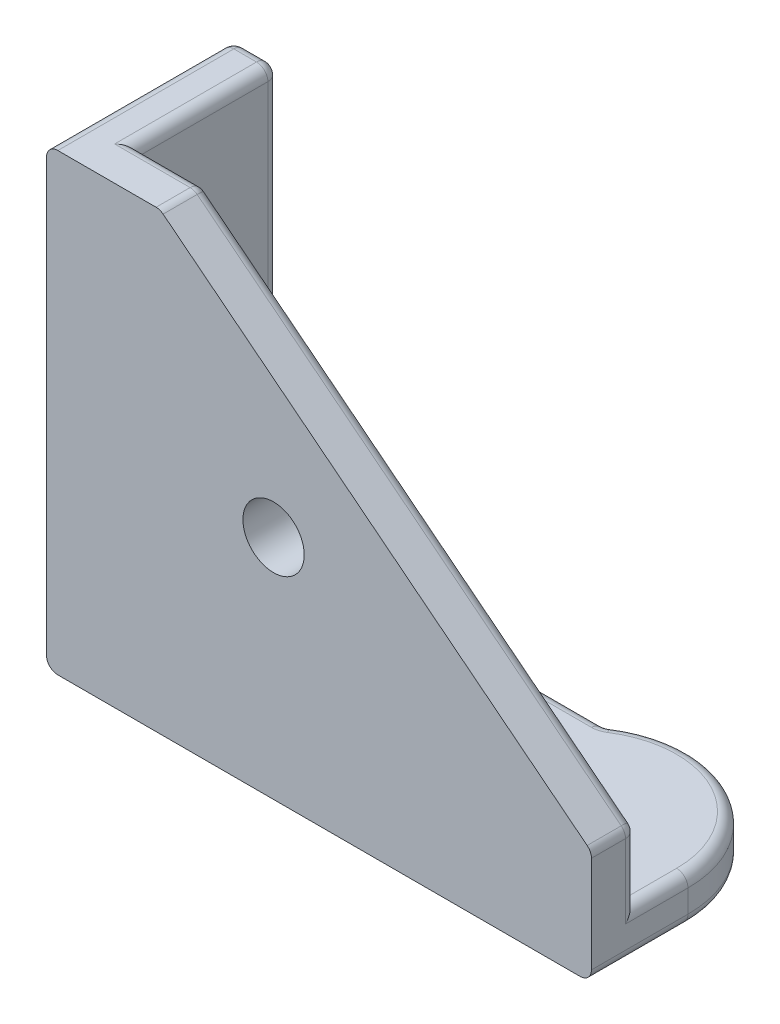
from build123d import *

# Parameters (mm, degrees)
BOSS_EXTRUDE1_DEPTH = 4
BOSS_EXTRUDE2_DEPTH = 12.5
SKETCH4_R           = 2.7
CUT_EXTRUDE1_DEPTH  = 4
SKETCH5_R           = 4.75
CUT_EXTRUDE2_DEPTH  = 8
CHAMFER1_SIZE       = 2.5
CHAMFER1_SIZE_2     = 1.750518846
FILLET1_R           = 1
BOSS_EXTRUDE3_DEPTH = 4
CUT_EXTRUDE3_DEPTH  = 4
SKETCH6_R           = 2.25
CUT_EXTRUDE4_DEPTH  = 4
FILLET2_R           = 1
SKETCH9_R           = 2.7
CUT_EXTRUDE5_DEPTH  = 4


with BuildPart() as part:
    # Sketch1 → Boss-Extrude1 (new body)
    with BuildSketch(Plane.XY):
        Polygon((0, 40), (0, 0), (48, 0), (48, 10), (10, 40), align=None)
    extrude(amount=BOSS_EXTRUDE1_DEPTH)

    # Sketch2 → Boss-Extrude2 (add)
    with BuildSketch(Plane(origin=(0, 0, 0), x_dir=(-1, 0, 0), z_dir=(0, 0, -1))):
        Polygon((0, 0), (-48, 0), (-48, 4), (-4, 4), (-4, 40), (0, 40), align=None)
    extrude(amount=BOSS_EXTRUDE2_DEPTH)

    # Sketch4 → Cut-Extrude1 (cut)
    with BuildSketch(Plane.ZY):
        with Locations(Location((-2.5, 31, 0), (0, 0, 270))):
            Circle(SKETCH4_R)
        with Locations(Location((-2.5, 13, 0), (0, 0, 270))):
            Circle(SKETCH4_R)
    extrude(amount=-CUT_EXTRUDE1_DEPTH, mode=Mode.SUBTRACT)

    # Sketch5 → Cut-Extrude2 (cut)
    with BuildSketch(Plane(origin=(4, 0, 0), x_dir=(0, 0, -1), z_dir=(1, 0, 0))):
        with Locations((2.5, 31)):
            Circle(SKETCH5_R)
        with Locations((2.5, 13)):
            Circle(SKETCH5_R)
    extrude(amount=CUT_EXTRUDE2_DEPTH, mode=Mode.SUBTRACT)

    # Chamfer1
    # the kernel refuses this chamfer: 2.5, 1.750518846 mm, written as the material it takes off along each edge
    with BuildSketch(Plane(origin=(12, 2.504745819, 0), x_dir=(-0.022209674198456777, 0, 0.9997533347641299), z_dir=(0, 1, 0))) as chamfer1_piece_1_section:
        Polygon((CHAMFER1_SIZE * 0.999753334764, CHAMFER1_SIZE * 0.0222096741985), (-CHAMFER1_SIZE_2 * 0.0222096741924, CHAMFER1_SIZE_2 * 0.999753334492), (0, 0), align=None)
    chamfer1_piece_1 = extrude(amount=20.990508362, mode=Mode.PRIVATE)
    chamfer1_piece_1 = chamfer1_piece_1 & Plane(origin=(12.629626374, 13, -2.5), x_dir=(0, 0, -1), z_dir=(-1, 0, 0)) * Cylinder(4.75, 52, mode=Mode.PRIVATE)
    add(chamfer1_piece_1, mode=Mode.SUBTRACT)
    with BuildSketch(Plane(origin=(12, 20.504745819, 0), x_dir=(-0.02220967419845678, 0, 0.9997533347641299), z_dir=(0, 1, 0))) as chamfer1_piece_2_section:
        Polygon((CHAMFER1_SIZE * 0.999753334764, CHAMFER1_SIZE * 0.0222096741985), (-CHAMFER1_SIZE_2 * 0.0222096741924, CHAMFER1_SIZE_2 * 0.999753334492), (0, 0), align=None)
    chamfer1_piece_2 = extrude(amount=20.990508362, mode=Mode.PRIVATE)
    chamfer1_piece_2 = chamfer1_piece_2 & Plane(origin=(12.629626374, 31, -2.5), x_dir=(0, 0, -1), z_dir=(-1, 0, 0)) * Cylinder(4.75, 52, mode=Mode.PRIVATE)
    add(chamfer1_piece_2, mode=Mode.SUBTRACT)

    # Fillet1
    fillet1_edges = [part.edges().sort_by_distance(p)[0] for p in [
        (8, 17.038873605, 0),
        (8, 8.961126395, 0),
        (8, 35.038873605, 0),
        (8, 26.961126395, 0),
        (13.750518846, 13, 0),
        (12.175051885, 13, 2.25),
        (13.750518846, 31, 0),
        (12.175051885, 31, 2.25),
    ]]
    fillet(fillet1_edges, radius=FILLET1_R)

    # Sketch8 → Boss-Extrude3 (add)
    with BuildSketch(Plane.XZ):
        with BuildLine():
            ThreePointArc((32.814564739, -12.5), (38.3, -14.2), (43.785435261, -12.5))
            Line((43.785435261, -12.5), (32.814564739, -12.5))
        make_face()
    extrude(amount=-BOSS_EXTRUDE3_DEPTH)

    # Sketch8<3> → Cut-Extrude3 (cut)
    with BuildSketch(Plane.XZ):
        with BuildLine():
            Line((43.785435261, -12.5), (48, -12.5))
            Line((48, -12.5), (48, -4.5))
            ThreePointArc((48, -4.5), (46.88192059, -9.021132489), (43.785435261, -12.5))
        make_face()
    extrude(amount=-CUT_EXTRUDE3_DEPTH, mode=Mode.SUBTRACT)

    # Sketch6 → Cut-Extrude4 (cut)
    with BuildSketch(Plane.XZ):
        with Locations(Location((38.3, -4.5, 0), (0, 0, 270))):
            Circle(SKETCH6_R)
    extrude(amount=-CUT_EXTRUDE4_DEPTH, mode=Mode.SUBTRACT)

    # Fillet2
    fillet2_edges = [part.edges().sort_by_distance(p)[0] for p in [
        (48, 0, -0.25),
        (42.821132489, 0, -13.08192059),
        (48, 4, -2.25),
        (4, 22, -12.5),
        (2, 40, -12.5),
        (0, 20, -12.5),
        (16.40728237, 0, -12.5),
        (32.814564739, 2, -12.5),
        (18.40728237, 4, -12.5),
        (0, 0, -4.25),
        (48, 7, 0),
        (48, 10, 2),
        (29, 25, 0),
        (10, 40, 2),
        (7, 40, 0),
        (0, 40, -4.25),
        (4, 40, -6.25),
        (42.821132489, 4, -13.08192059),
    ]]
    fillet(fillet2_edges, radius=FILLET2_R)

    # Sketch9 → Cut-Extrude5 (cut)
    with BuildSketch(Plane.XY.offset(4)):
        with Locations((20, 20)):
            Circle(SKETCH9_R)
    extrude(amount=-CUT_EXTRUDE5_DEPTH, mode=Mode.SUBTRACT)


solid = part.part
